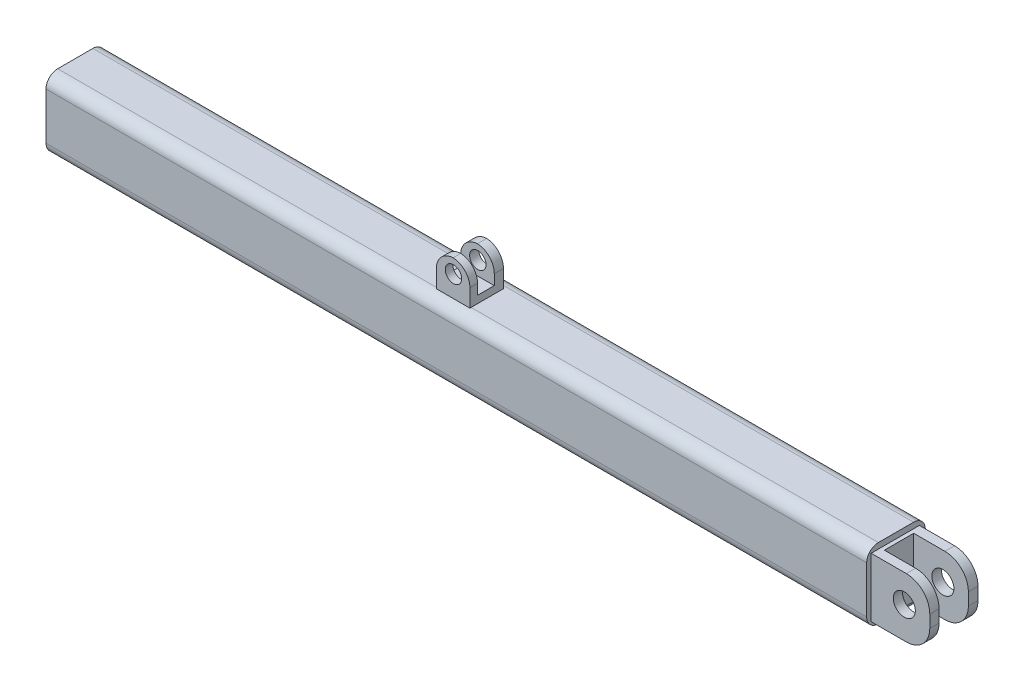
from build123d import *

# Parameters (mm, degrees)
SKETCH1_W               = 70
SKETCH1_H               = 6
BOSS_EXTRUDE1_DEPTH     = 5
SKETCH5_W               = 4.113429611
SKETCH5_H               = 5.054148352
BOSS_EXTRUDE4_DEPTH     = 40
SKETCH9_W               = 5.188919622
SKETCH9_H               = 2.498562964
CUT_EXTRUDE6_DEPTH      = 6
FILLET14_R              = 1
FILLET15_R              = 1
SKETCH11_R              = 0.939549209
CUT_EXTRUDE8_DEPTH      = 6
FILLET19_R              = 2
SKETCH12_W              = 2.865541581
SKETCH12_H              = 2.859268941
BOSS_EXTRUDE5_DEPTH     = 6
CUT_EXTRUDE9_DEPTH      = 12
CUT_EXTRUDE9_DEPTH_BACK = 5
SKETCH13_W              = 1.424860979
SKETCH13_H              = 2.636738839
SKETCH14_R              = 0.7
CUT_EXTRUDE10_DEPTH     = 13
FILLET20_R              = 1.5


with BuildPart() as part:
    # Sketch1 → Boss-Extrude1 (new body)
    with BuildSketch(Plane.XY):
        Rectangle(SKETCH1_W, SKETCH1_H)
    extrude(amount=BOSS_EXTRUDE1_DEPTH)

    # Sketch5 → Boss-Extrude4 (add)
    with BuildSketch(Plane(origin=(0, 0, 0), x_dir=(0, 0, -1), z_dir=(1, 0, 0))):
        with Locations((-2.56083925, -0.011702819)):
            Rectangle(SKETCH5_W, SKETCH5_H)
    extrude(amount=BOSS_EXTRUDE4_DEPTH)

    # Sketch9 → Cut-Extrude6 (cut)
    with BuildSketch(Plane.XZ.offset(2.538776995)):
        with Locations((37.929941449, 2.575384926)):
            Rectangle(SKETCH9_W, SKETCH9_H)
    extrude(amount=-CUT_EXTRUDE6_DEPTH, mode=Mode.SUBTRACT)

    # Fillet14
    fillet14_edges = [part.edges().sort_by_distance(p)[0] for p in [
        (0, 3, 5),
    ]]
    fillet(fillet14_edges, radius=FILLET14_R)

    # Fillet15
    fillet15_edges = [part.edges().sort_by_distance(p)[0] for p in [
        (0, -3, 5),
        (0, -3, 0),
        (0, 3, 0),
    ]]
    fillet(fillet15_edges, radius=FILLET15_R)

    # Sketch11 → Cut-Extrude8 (cut)
    with BuildSketch(Plane(origin=(0, 0, 0.504124444), x_dir=(-1, 0, 0), z_dir=(0, 0, -1))):
        with Locations((-37.826949183, 0.145030674)):
            Circle(SKETCH11_R)
    extrude(amount=-CUT_EXTRUDE8_DEPTH, mode=Mode.SUBTRACT)

    # Fillet19
    fillet19_edges = [part.edges().sort_by_distance(p)[0] for p in [
        (40, 2.515371357, 0.915113944),
        (40, -2.538776995, 4.221110231),
        (40, 2.515371357, 4.221110231),
        (40, -2.538776995, 0.915113944),
    ]]
    fillet(fillet19_edges, radius=FILLET19_R)

    # Sketch12 → Boss-Extrude5 (add)
    with BuildSketch(Plane(origin=(0, 0, 0), x_dir=(1, 0, 0), z_dir=(0, 1, 0))):
        with Locations((-1.172253324, -2.671686226)):
            Rectangle(SKETCH12_W, SKETCH12_H)
    extrude(amount=BOSS_EXTRUDE5_DEPTH)

    # Sketch13 → Cut-Extrude9 (cut, two sides: drawn at the far end of the back side and taken through both)
    with BuildSketch(Plane(origin=(0, 0, 0), x_dir=(0, 0, -1), z_dir=(1, 0, 0)).offset(-CUT_EXTRUDE9_DEPTH_BACK)):
        with Locations((-2.737982633, 4.937385392)):
            Rectangle(SKETCH13_W, SKETCH13_H)
    extrude(amount=CUT_EXTRUDE9_DEPTH + CUT_EXTRUDE9_DEPTH_BACK, mode=Mode.SUBTRACT)

    # Sketch14 → Cut-Extrude10 (cut)
    with BuildSketch(Plane.XY):
        with Locations(Location((-1.141664566, 4.804714943, 0), (0, 0, 180))):
            Circle(SKETCH14_R)
    extrude(amount=CUT_EXTRUDE10_DEPTH, mode=Mode.SUBTRACT)

    # Fillet20
    # the kernel refuses this fillet: 1.5 mm, written as the material it takes off along each edge
    with BuildSketch(Plane(origin=(0.260517466, 6, 7.851320696), x_dir=(0, -1, 0), z_dir=(0, 0, -1)), Plane(origin=(-2.605024115, 6, -0.299586878), x_dir=(0, -1, 0), z_dir=(0, 0, 1))) as fillet20_piece_1:
        with BuildLine():
            CenterArc((FILLET20_R, FILLET20_R), FILLET20_R, 180, 90)
            Line((0, FILLET20_R), (0, 0))
            Line((0, 0), (FILLET20_R, 0))
        make_face()
    extrude(amount=8.150907574, mode=Mode.SUBTRACT)
    with BuildSketch(Plane(origin=(0.260517466, 6, 5.775552143), x_dir=(0, -1, 0), z_dir=(0, 0, -1)), Plane(origin=(-2.605024115, 6, -2.507948245), x_dir=(0, -1, 0), z_dir=(0, 0, 1))) as fillet20_piece_2:
        with BuildLine():
            CenterArc((FILLET20_R, FILLET20_R), FILLET20_R, 180, 90)
            Line((0, FILLET20_R), (0, 0))
            Line((0, 0), (FILLET20_R, 0))
        make_face()
    extrude(amount=8.283500388, mode=Mode.SUBTRACT)


solid = part.part
